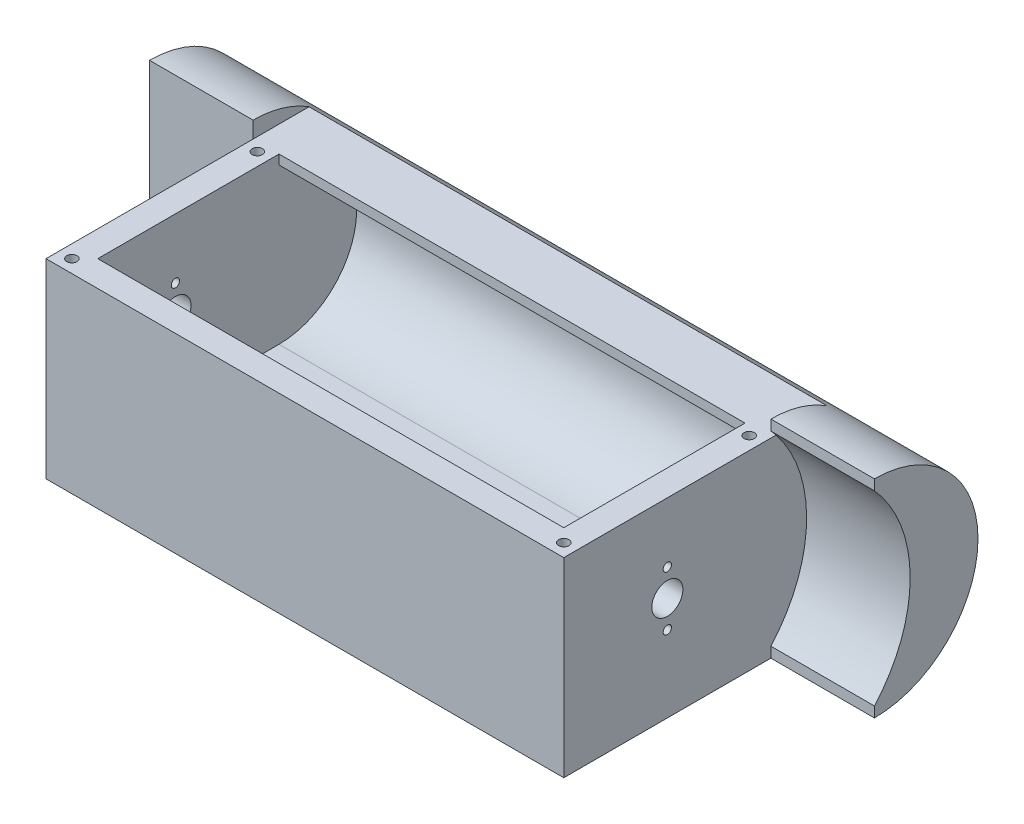
from build123d import *

# Parameters (mm, degrees)
BOSS_EXTRUDE1_DEPTH = 100
SHELL3_START        = 5
SHELL3_DEPTH        = 90
BOSS_EXTRUDE2_DEPTH = 20
SKETCH7_W           = 100
SKETCH7_H           = 50.81
CUT_EXTRUDE6_DEPTH  = 3.175
CUT_EXTRUDE1_REACH  = 130.062
SKETCH2_R           = 0.8
SKETCH2_R_2         = 3
SKETCH8_R           = 1
CUT_EXTRUDE7_DEPTH  = 3
CUT_EXTRUDE8_DEPTH  = 20


# Read off the part's stored shape, not the designer's step: Shell3
with BuildPart() as part:
    # Sketch1 → Boss-Extrude1 (new body)
    with BuildSketch(Plane(origin=(0, 0, 0), x_dir=(0, 0, -1), z_dir=(1, 0, 0))):
        with BuildLine():
            Line((-20, 20), (20, 20))
            ThreePointArc((20, 20), (40, 0), (20, -20))
            Line((20, -20), (-20, -20))
            Line((-20, -20), (-20, 20))
        make_face()
    extrude(amount=BOSS_EXTRUDE1_DEPTH)

    # Shell3 outline → Shell3 (cut)
    with BuildSketch(Plane.YZ.offset(SHELL3_START)):
        with BuildLine():
            Line((15, -20), (20, -20))
            Line((20, -20), (20, 15))
            Line((20, 15), (-15, 15))
            Line((-15, 15), (-15, -20))
            ThreePointArc((-15, -20), (0, -35), (15, -20))
        make_face()
    extrude(amount=SHELL3_DEPTH, mode=Mode.SUBTRACT)

    # Sketch9 → Boss-Extrude2 (add)
    with BuildSketch(Plane(origin=(100, 0, 0), x_dir=(0, 0, -1), z_dir=(1, 0, 0))):
        with BuildLine():
            Line((20, 20), (20, -20))
            ThreePointArc((20, -20), (40, 0), (20, 20))
        make_face()
    boss_extrude2 = extrude(amount=BOSS_EXTRUDE2_DEPTH)

    # Mirror1: Boss-Extrude2 across plane
    add(boss_extrude2.mirror(Plane(origin=(50, 0, 0), x_dir=(0, 0, 1), z_dir=(1, 0, 0))))

    # Sketch7 → Cut-Extrude6 (cut)
    with BuildSketch(Plane(origin=(0, 20, 0), x_dir=(1, 0, 0), z_dir=(0, 1, 0))):
        with Locations((50, 5.405)):
            Rectangle(SKETCH7_W, SKETCH7_H)
    extrude(amount=-CUT_EXTRUDE6_DEPTH, mode=Mode.SUBTRACT)

    # Cut-Extrude1: up to this face of the body (flat: up to its plane)
    cut_extrude1_end = Plane(part.part.faces().sort_by_distance((0, -1.5875, 0))[0])
    # Sketch2 → Cut-Extrude1 (cut, up to the picked face)
    with BuildSketch(Plane(origin=(100, 0, 0), x_dir=(0, 0, -1), z_dir=(1, 0, 0)), mode=Mode.PRIVATE) as cut_extrude1_sk1:
        with Locations(Location((0, -5.25, 0), (0, 0, 180))):
            Circle(SKETCH2_R)
    cut_extrude1_tool1 = split(extrude(cut_extrude1_sk1.sketch, amount=-CUT_EXTRUDE1_REACH, mode=Mode.PRIVATE), bisect_by=cut_extrude1_end, keep=Keep.BOTH, mode=Mode.PRIVATE)
    # Sketch2 → Cut-Extrude1 (cut, up to the picked face)
    with BuildSketch(Plane(origin=(100, 0, 0), x_dir=(0, 0, -1), z_dir=(1, 0, 0)), mode=Mode.PRIVATE) as cut_extrude1_sk2:
        with Locations(Location((0, 0, 0), (0, 0, 180))):
            Circle(SKETCH2_R_2)
    cut_extrude1_tool2 = split(extrude(cut_extrude1_sk2.sketch, amount=-CUT_EXTRUDE1_REACH, mode=Mode.PRIVATE), bisect_by=cut_extrude1_end, keep=Keep.BOTH, mode=Mode.PRIVATE)
    # Sketch2 → Cut-Extrude1 (cut, up to the picked face)
    with BuildSketch(Plane(origin=(100, 0, 0), x_dir=(0, 0, -1), z_dir=(1, 0, 0)), mode=Mode.PRIVATE) as cut_extrude1_sk3:
        with Locations(Location((0, 5.25, 0), (0, 0, 180))):
            Circle(SKETCH2_R)
    cut_extrude1_tool3 = split(extrude(cut_extrude1_sk3.sketch, amount=-CUT_EXTRUDE1_REACH, mode=Mode.PRIVATE), bisect_by=cut_extrude1_end, keep=Keep.BOTH, mode=Mode.PRIVATE)
    add(cut_extrude1_tool1.solids().sort_by(Axis((100, -5.25, 0), (-1, 0, 0)))[0], mode=Mode.SUBTRACT)
    add(cut_extrude1_tool2.solids().sort_by(Axis((100, 0, 0), (-1, 0, 0)))[0], mode=Mode.SUBTRACT)
    add(cut_extrude1_tool3.solids().sort_by(Axis((100, 5.25, 0), (-1, 0, 0)))[0], mode=Mode.SUBTRACT)

    # Sketch8 → Cut-Extrude7 (cut)
    with BuildSketch(Plane(origin=(0, 16.825, 0), x_dir=(1, 0, 0), z_dir=(0, 1, 0))):
        with Locations(Location((97.5, -17.5, 0), (0, 0, 270))):
            Circle(SKETCH8_R)
        with Locations(Location((97.5, 18.31, 0), (0, 0, 270))):
            Circle(SKETCH8_R)
        with Locations(Location((2.5, -17.5, 0), (0, 0, 90))):
            Circle(SKETCH8_R)
        with Locations(Location((2.5, 18.31, 0), (0, 0, 90))):
            Circle(SKETCH8_R)
    extrude(amount=-CUT_EXTRUDE7_DEPTH, mode=Mode.SUBTRACT)

    # Sketch10 → Cut-Extrude8 (cut)
    with BuildSketch(Plane(origin=(120, 0, 0), x_dir=(0, 0, -1), z_dir=(1, 0, 0))):
        with BuildLine():
            Line((20, 17.989163405), (20, -17.989163405))
            ThreePointArc((20, -17.989163405), (26.9, 0), (20, 17.989163405))
        make_face()
    extrude(amount=-CUT_EXTRUDE8_DEPTH, mode=Mode.SUBTRACT)


solid = part.part
